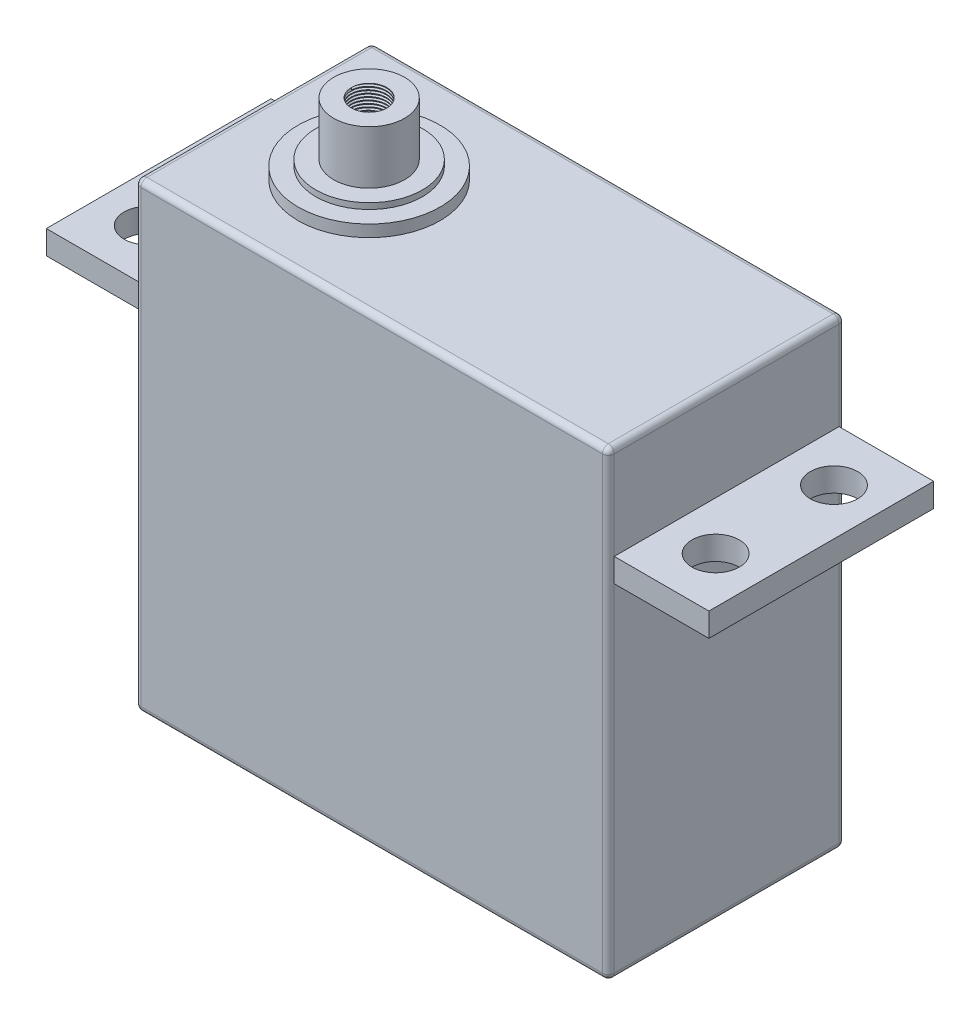
from build123d import *
from build123d.topology import SkipClean

# Parameters (mm, degrees)
SKETCH_1_W          = 40
SKETCH_1_H          = 39
EXTRUDE_2_DEPTH     = 20
FILLET_2_R          = 0.5
FILLET_3_R          = 0.5
FILLET_4_R          = 0.5
FILLET_5_R          = 0.5
SKETCH_6_W          = 19
SKETCH_6_H          = 2
EXTRUDE_3_DEPTH     = 8
SKETCH_7_W          = 19
SKETCH_7_H          = 2
EXTRUDE_5_DEPTH     = 8
SKETCH_8_R          = 2
CUT_EXTRUDE_1_DEPTH = 28
SKETCH_9_R          = 6
SKETCH_9_R_2        = 4.5
EXTRUDE_7_DEPTH     = 1
SKETCH_10_R         = 4.5
EXTRUDE_8_DEPTH     = 1.5
SKETCH_11_R         = 3
EXTRUDE_9_DEPTH     = 4.5
SKETCH_12_R         = 1.5
CUT_EXTRUDE_2_DEPTH = 6
THREAD_1_PITCH      = 0.25


with BuildPart() as part:
    # 草图1 → 凸台-拉伸2 (new body)
    with BuildSketch(Plane.XY):
        with Locations((20, 19.5)):
            Rectangle(SKETCH_1_W, SKETCH_1_H)
    extrude(amount=EXTRUDE_2_DEPTH)

    # 圆角2
    fillet_2_edges = [part.edges().sort_by_distance(p)[0] for p in [
        (40, 19.5, 20),
        (20, 39, 20),
    ]]
    fillet(fillet_2_edges, radius=FILLET_2_R)

    # 圆角3
    fillet_3_edges = [part.edges().sort_by_distance(p)[0] for p in [
        (40, 0, 9.75),
        (19.75, 0, 20),
        (39.853553391, 0, 19.853553391),
        (0, 39, 9.75),
        (0, 38.853553391, 19.853553391),
        (0, 19.25, 20),
    ]]
    fillet(fillet_3_edges, radius=FILLET_3_R)

    # 圆角4
    # the kernel refuses this fillet: 0.5 mm, written as the material it takes off along each edge
    with BuildSketch(Plane(origin=(39.5, 38.5, 19.5), x_dir=(0, 1, 0), z_dir=(1, 0, 0))) as fillet_4_piece_1_section:
        Polygon((0, 0), (FILLET_4_R, 0), (FILLET_4_R, FILLET_4_R), (0, FILLET_4_R), align=None)
    fillet_4_piece_1 = extrude(amount=FILLET_4_R, mode=Mode.PRIVATE)
    fillet_4_piece_1 = fillet_4_piece_1 - Plane(origin=(39.5, 38.5, 19.5), x_dir=(0, -0.7071067811865475, -0.7071067811865475), z_dir=(1, 0, 0)) * Sphere(FILLET_4_R, mode=Mode.PRIVATE)
    add(fillet_4_piece_1, mode=Mode.SUBTRACT)
    with BuildSketch(Plane(origin=(40, 39, -1.25), x_dir=(0, -1, 0), z_dir=(0, 0, 1))) as fillet_4_piece_2:
        with BuildLine():
            CenterArc((FILLET_4_R, -FILLET_4_R), FILLET_4_R, 90, 90)
            Line((0, -FILLET_4_R), (0, 0))
            Line((0, 0), (FILLET_4_R, 0))
        make_face()
    extrude(amount=20.75, mode=Mode.SUBTRACT)
    with BuildSketch(Plane(origin=(40, 0.5, 0), x_dir=(-1, 0, 0), z_dir=(0, 1, 0))) as fillet_4_piece_3:
        with BuildLine():
            CenterArc((FILLET_4_R, FILLET_4_R), FILLET_4_R, 180, 90)
            Line((0, FILLET_4_R), (0, 0))
            Line((0, 0), (FILLET_4_R, 0))
        make_face()
    extrude(amount=39.75, mode=Mode.SUBTRACT)
    with BuildSketch(Plane(origin=(39.5, 0.5, 0), x_dir=(0, -1, 0), z_dir=(-1, 0, 0))) as fillet_4_piece_4:
        with BuildLine():
            CenterArc((0.5 - FILLET_4_R, FILLET_4_R), FILLET_4_R, 270, 90)
            Line((0.5, FILLET_4_R), (0.5, 0))
            Line((0.5, 0), (0.5 - FILLET_4_R, 0))
        make_face()
    revolve(axis=Axis((39.5, 0.5, 0), (0, 0, 1)), revolution_arc=90, mode=Mode.SUBTRACT)
    with BuildSketch(Plane(origin=(-1.25, 0, 0), x_dir=(0, 0, 1), z_dir=(1, 0, 0))) as fillet_4_piece_5:
        with BuildLine():
            CenterArc((FILLET_4_R, -FILLET_4_R), FILLET_4_R, 90, 90)
            Line((0, -FILLET_4_R), (0, 0))
            Line((0, 0), (FILLET_4_R, 0))
        make_face()
    extrude(amount=40.75, mode=Mode.SUBTRACT)

    # 圆角5
    # the kernel refuses this fillet: 0.5 mm, written as the material it takes off along each edge
    with BuildSketch(Plane(origin=(0.5, 0.5, 19.5), x_dir=(-1, 0, 0), z_dir=(0, -1, 0))) as fillet_5_piece_1_section:
        Polygon((0, 0), (FILLET_5_R, 0), (FILLET_5_R, -FILLET_5_R), (0, -FILLET_5_R), align=None)
    fillet_5_piece_1 = extrude(amount=FILLET_5_R, mode=Mode.PRIVATE)
    fillet_5_piece_1 = fillet_5_piece_1 - Plane(origin=(0.5, 0.5, 19.5), x_dir=(0.7071067811865475, 0, -0.7071067811865475), z_dir=(0, -1, 0)) * Sphere(FILLET_5_R, mode=Mode.PRIVATE)
    add(fillet_5_piece_1, mode=Mode.SUBTRACT)
    with BuildSketch(Plane(origin=(39.5, 38.5, 0.5), x_dir=(0, 1, 0), z_dir=(0, 0, -1))) as fillet_5_piece_2_section:
        Polygon((0, 0), (FILLET_5_R, 0), (FILLET_5_R, FILLET_5_R), (0, FILLET_5_R), align=None)
    fillet_5_piece_2 = extrude(amount=FILLET_5_R, mode=Mode.PRIVATE)
    fillet_5_piece_2 = fillet_5_piece_2 - Plane(origin=(39.5, 38.5, 0.5), x_dir=(-0.7071067811865475, -0.7071067811865477, 0), z_dir=(0, 0, -1)) * Sphere(FILLET_5_R, mode=Mode.PRIVATE)
    add(fillet_5_piece_2, mode=Mode.SUBTRACT)
    with BuildSketch(Plane(origin=(39.5, 39, 0), x_dir=(0, -1, 0), z_dir=(-1, 0, 0))) as fillet_5_piece_3:
        with BuildLine():
            CenterArc((FILLET_5_R, FILLET_5_R), FILLET_5_R, 180, 90)
            Line((0, FILLET_5_R), (0, 0))
            Line((0, 0), (FILLET_5_R, 0))
        make_face()
    extrude(amount=39, mode=Mode.SUBTRACT)
    with BuildSketch(Plane(origin=(0.5, 38.5, 0), x_dir=(-1, 0, 0), z_dir=(0, -1, 0))) as fillet_5_piece_4:
        with BuildLine():
            CenterArc((0.5 - FILLET_5_R, -FILLET_5_R), FILLET_5_R, 0, 90)
            Line((0.5, -FILLET_5_R), (0.5, 0))
            Line((0.5, 0), (0.5 - FILLET_5_R, 0))
        make_face()
    revolve(axis=Axis((0.5, 38.5, 0), (0, 0, -1)), revolution_arc=90, mode=Mode.SUBTRACT)
    with BuildSketch(Plane(origin=(0, 0, 0.5), x_dir=(1, 0, 0), z_dir=(0, 0, 1))) as fillet_5_piece_5:
        with BuildLine():
            CenterArc((FILLET_5_R, FILLET_5_R), FILLET_5_R, 180, 90)
            Line((0, FILLET_5_R), (0, 0))
            Line((0, 0), (FILLET_5_R, 0))
        make_face()
    extrude(amount=19, mode=Mode.SUBTRACT)
    with BuildSketch(Plane(origin=(0, 38.5, 0), x_dir=(0, 0, 1), z_dir=(0, -1, 0))) as fillet_5_piece_6:
        with BuildLine():
            CenterArc((FILLET_5_R, -FILLET_5_R), FILLET_5_R, 90, 90)
            Line((0, -FILLET_5_R), (0, 0))
            Line((0, 0), (FILLET_5_R, 0))
        make_face()
    extrude(amount=38, mode=Mode.SUBTRACT)
    with BuildSketch(Plane(origin=(0, 0.5, 0.5), x_dir=(0, 0, -1), z_dir=(0, 1, 0))) as fillet_5_piece_7:
        with BuildLine():
            CenterArc((0.5 - FILLET_5_R, -FILLET_5_R), FILLET_5_R, 0, 90)
            Line((0.5 - FILLET_5_R, 0), (0.5, 0))
            Line((0.5, 0), (0.5, -FILLET_5_R))
        make_face()
    revolve(axis=Axis((0, 0.5, 0.5), (-1, 0, 0)), revolution_arc=90, mode=Mode.SUBTRACT)

    # 草图6 → 凸台-拉伸3 (add)
    with BuildSketch(Plane.ZY):
        with Locations((10, 30)):
            Rectangle(SKETCH_6_W, SKETCH_6_H)
    extrude(amount=EXTRUDE_3_DEPTH)

    # 草图7 → 凸台-拉伸5 (add)
    with BuildSketch(Plane(origin=(40, 0, 0), x_dir=(0, 0, -1), z_dir=(1, 0, 0))):
        with Locations((-10, 30)):
            Rectangle(SKETCH_7_W, SKETCH_7_H)
    extrude(amount=EXTRUDE_5_DEPTH)

    # 草图8 → 切除-拉伸1 (cut)
    with BuildSketch(Plane(origin=(0, 39, 0), x_dir=(1, 0, 0), z_dir=(0, 1, 0))):
        with Locations(Location((-3.928154272, -5, 0), (0, 0, 180))):
            Circle(SKETCH_8_R)
        with Locations(Location((-3.928154272, -15, 0), (0, 0, 180))):
            Circle(SKETCH_8_R)
        with Locations(Location((44.071845728, -5, 0), (0, 0, 180))):
            Circle(SKETCH_8_R)
        with Locations(Location((44.071845728, -15, 0), (0, 0, 180))):
            Circle(SKETCH_8_R)
    extrude(amount=-CUT_EXTRUDE_1_DEPTH, mode=Mode.SUBTRACT)

    # 草图9 → 凸台-拉伸7 (add)
    with BuildSketch(Plane(origin=(0, 39, 0), x_dir=(1, 0, 0), z_dir=(0, 1, 0))):
        with Locations(Location((10.071845728, -10.288024079, 0), (0, 0, 270))):
            Circle(SKETCH_9_R)
        with Locations(Location((10.071845728, -10.288024079, 0), (0, 0, 270))):
            Circle(SKETCH_9_R_2, mode=Mode.SUBTRACT)
    extrude(amount=EXTRUDE_7_DEPTH)

    # 草图10 → 凸台-拉伸8 (add)
    with BuildSketch(Plane(origin=(0, 39, 0), x_dir=(1, 0, 0), z_dir=(0, 1, 0))):
        with Locations(Location((10.071845728, -10.288024079, 0), (0, 0, 270))):
            Circle(SKETCH_10_R)
    extrude(amount=EXTRUDE_8_DEPTH)

    # 草图11 → 凸台-拉伸9 (add)
    with BuildSketch(Plane(origin=(0, 40.5, 0), x_dir=(1, 0, 0), z_dir=(0, 1, 0))):
        with Locations(Location((10.071845728, -10.288024079, 0), (0, 0, 270))):
            Circle(SKETCH_11_R)
    extrude(amount=EXTRUDE_9_DEPTH)

    # 草图12 → 切除-拉伸2 (cut)
    with BuildSketch(Plane(origin=(0, 45, 0), x_dir=(1, 0, 0), z_dir=(0, 1, 0))):
        with Locations(Location((10.071845728, -10.288024079, 0), (0, 0, 270))):
            Circle(SKETCH_12_R)
    extrude(amount=-CUT_EXTRUDE_2_DEPTH, mode=Mode.SUBTRACT)

    # 螺纹线1: the profile of 螺纹线轮廓2 profile screwed along a right-hand helix of 24 turns, 6 arcs to a turn; built about Z, then put on its axis
    with SkipClean():  # the faces are left unmerged after this step: merging them gives an invalid solid
        thread_1_z = Axis((0, 0, 0), (0, 0, 1))
        thread_1_corners = [(1.4997, 0, -0.000173205), (1.635316468, 0, 0.078125), (1.635316468, 0, 0.109375), (1.4997, 0, 0.187673204)]
        with BuildLine(mode=Mode.PRIVATE) as thread_1_profile:
            Line(thread_1_corners[0], thread_1_corners[1])
            Line(thread_1_corners[1], thread_1_corners[2])
            Line(thread_1_corners[2], thread_1_corners[3])
            Line(thread_1_corners[3], thread_1_corners[0])
        thread_1_cap = Face(thread_1_profile.wire())
        thread_1_turn_angles = [0, 30, 60, 90, 120, 150, 180, 210, 240, 270, 300, 330, 360]
        thread_1_turn_weights = [1, 0.8660254037844387, 1, 0.8660254037844387, 1, 0.8660254037844387, 1, 0.8660254037844387, 1, 0.8660254037844387, 1, 0.8660254037844387, 1]
        thread_1_turn_rails = [Edge.make_bspline([Vector(p[0], p[1], 0).rotate(thread_1_z, thread_1_turn_angles[k]) / thread_1_turn_weights[k] + Vector(0, 0, p[2] + THREAD_1_PITCH * thread_1_turn_angles[k] / 360) for k in range(13)], [0, 0, 0, 1, 1, 2, 2, 3, 3, 4, 4, 5, 5, 6, 6, 6], 2, thread_1_turn_weights) for p in thread_1_corners]
        thread_1_turn_sides = [Face.make_surface_from_curves(thread_1_turn_rails[p[0]], thread_1_turn_rails[p[1]]) for p in [(0, 1), (1, 2), (2, 3), (3, 0)]]
        thread_1 = Plane(origin=(10.071845728, 45, 10.288024079), x_dir=(-1, 0, 0), z_dir=(0, -1, 0)) * Solid(Shell([*[p.moved(Location((0, 0, THREAD_1_PITCH * i))) for i in range(24) for p in thread_1_turn_sides], thread_1_cap, thread_1_cap.rotate(thread_1_z, 8640).moved(Location((0, 0, THREAD_1_PITCH * 8640 / 360)))]))
        add(thread_1, mode=Mode.SUBTRACT)


solid = part.part
